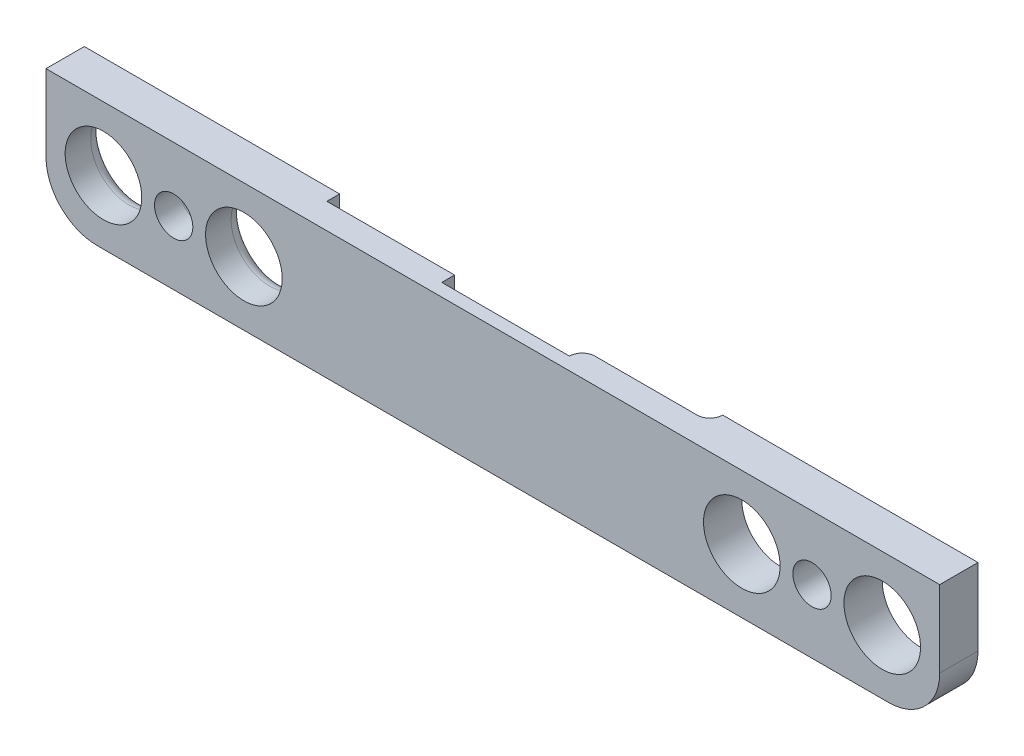
from build123d import *

# Parameters (mm, degrees)
SKETCH1_W           = 20
SKETCH1_H           = 10
SKETCH1_R           = 3
SKETCH1_R_2         = 1.5
BOSS_EXTRUDE1_DEPTH = 3
SKETCH2_W           = 10
SKETCH2_H           = 10
BOSS_EXTRUDE2_DEPTH = 2
SKETCH3_W           = 10
SKETCH3_H           = 10
BOSS_EXTRUDE3_DEPTH = 1
FILLET1_R           = 4
FILLET2_START       = -5
FILLET2_DEPTH       = 12
FILLET2_START_2     = -3.811659193
FILLET2_2_DEPTH     = 10
FILLET3_R           = 1


with BuildPart() as part:
    # Sketch1 → Boss-Extrude1 (new body)
    with BuildSketch(Plane.XY):
        with Locations((1.143497758, 1.188340807)):
            Rectangle(SKETCH1_W, SKETCH1_H)
        with Locations((-4.356502242, 1.188340807)):
            Circle(SKETCH1_R, mode=Mode.SUBTRACT)
        with Locations((6.643497758, 1.188340807)):
            Circle(SKETCH1_R, mode=Mode.SUBTRACT)
        with Locations((1.143497758, 1.188340807)):
            Circle(SKETCH1_R_2, mode=Mode.SUBTRACT)
    extrude(amount=BOSS_EXTRUDE1_DEPTH)

    # Sketch2 → Boss-Extrude2 (add)
    with BuildSketch(Plane.XY.offset(3)):
        with Locations((16.143497758, 1.188340807)):
            Rectangle(SKETCH2_W, SKETCH2_H)
    extrude(amount=-BOSS_EXTRUDE2_DEPTH)

    # Sketch3 → Boss-Extrude3 (add)
    with BuildSketch(Plane.XY.offset(3)):
        with Locations((26.143497758, 1.188340807)):
            Rectangle(SKETCH3_W, SKETCH3_H)
    extrude(amount=-BOSS_EXTRUDE3_DEPTH)


with BuildPart() as body_2:
    # Mirror3: mirrored copy
    add(part.part.mirror(Plane(origin=(26.143497758, 0, 0), x_dir=(0, 0, 1), z_dir=(1, 0, 0))))


with BuildPart() as part_1:
    add(part.part)

    # Combine1: union body 2
    add(body_2.part)

    # Fillet1
    fillet1_edges = [part_1.edges().sort_by_distance(p)[0] for p in [
        (61.143497758, -3.811659193, 1.5),
        (-8.856502242, -3.811659193, 1.5),
    ]]
    fillet(fillet1_edges, radius=FILLET1_R)

    # Fillet2: read off the stored shape, not the designer's step
    # Fillet2 outline → Fillet2 (cut)
    with BuildSketch(Plane(origin=(0, 0, 0), x_dir=(1, 0, 0), z_dir=(0, 1, 0)).offset(FILLET2_START)):
        with BuildLine():
            Line((31.143497758, -1), (31.143497758, -2))
            ThreePointArc((31.143497758, -2), (31.436390977, -1.292893219), (32.143497758, -1))
            Line((32.143497758, -1), (31.143497758, -1))
        make_face()
    extrude(amount=FILLET2_DEPTH, mode=Mode.SUBTRACT)

    # Fillet2 2 outline → Fillet2 2 (add)
    with BuildSketch(Plane(origin=(0, 0, 0), x_dir=(1, 0, 0), z_dir=(0, 1, 0)).offset(FILLET2_START_2)):
        with BuildLine():
            ThreePointArc((41.143497758, 0), (40.850604539, -0.707106781), (40.143497758, -1))
            Line((40.143497758, -1), (41.143497758, -1))
            Line((41.143497758, -1), (41.143497758, 0))
        make_face()
    extrude(amount=FILLET2_2_DEPTH)

    # Fillet3
    # the kernel refuses this fillet: 1 mm, written as the material it takes off along each edge
    with BuildSketch(Plane(origin=(-4.356502242, 1.188340807, 0), x_dir=(1, 0, 0), z_dir=(0, -1, 0))) as fillet3_piece_1:
        with BuildLine():
            CenterArc((3 + FILLET3_R, FILLET3_R), FILLET3_R, 180, 90)
            Line((3, FILLET3_R), (3, 0))
            Line((3, 0), (3 + FILLET3_R, 0))
        make_face()
    revolve(axis=Axis((-4.356502242, 1.188340807, 0), (0, 0, 1)), mode=Mode.SUBTRACT)
    with BuildSketch(Plane(origin=(6.643497758, 1.188340807, 0), x_dir=(1, 0, 0), z_dir=(0, -1, 0))) as fillet3_piece_2:
        with BuildLine():
            CenterArc((3 + FILLET3_R, FILLET3_R), FILLET3_R, 180, 90)
            Line((3, FILLET3_R), (3, 0))
            Line((3, 0), (3 + FILLET3_R, 0))
        make_face()
    revolve(axis=Axis((6.643497758, 1.188340807, 0), (0, 0, 1)), mode=Mode.SUBTRACT)
    with BuildSketch(Plane(origin=(1.143497758, 1.188340807, 0), x_dir=(1, 0, 0), z_dir=(0, -1, 0))) as fillet3_piece_3:
        with BuildLine():
            CenterArc((1.5 + FILLET3_R, FILLET3_R), FILLET3_R, 180, 90)
            Line((1.5, FILLET3_R), (1.5, 0))
            Line((1.5, 0), (1.5 + FILLET3_R, 0))
        make_face()
    revolve(axis=Axis((1.143497758, 1.188340807, 0), (0, 0, 1)), mode=Mode.SUBTRACT)


solid = part_1.part
